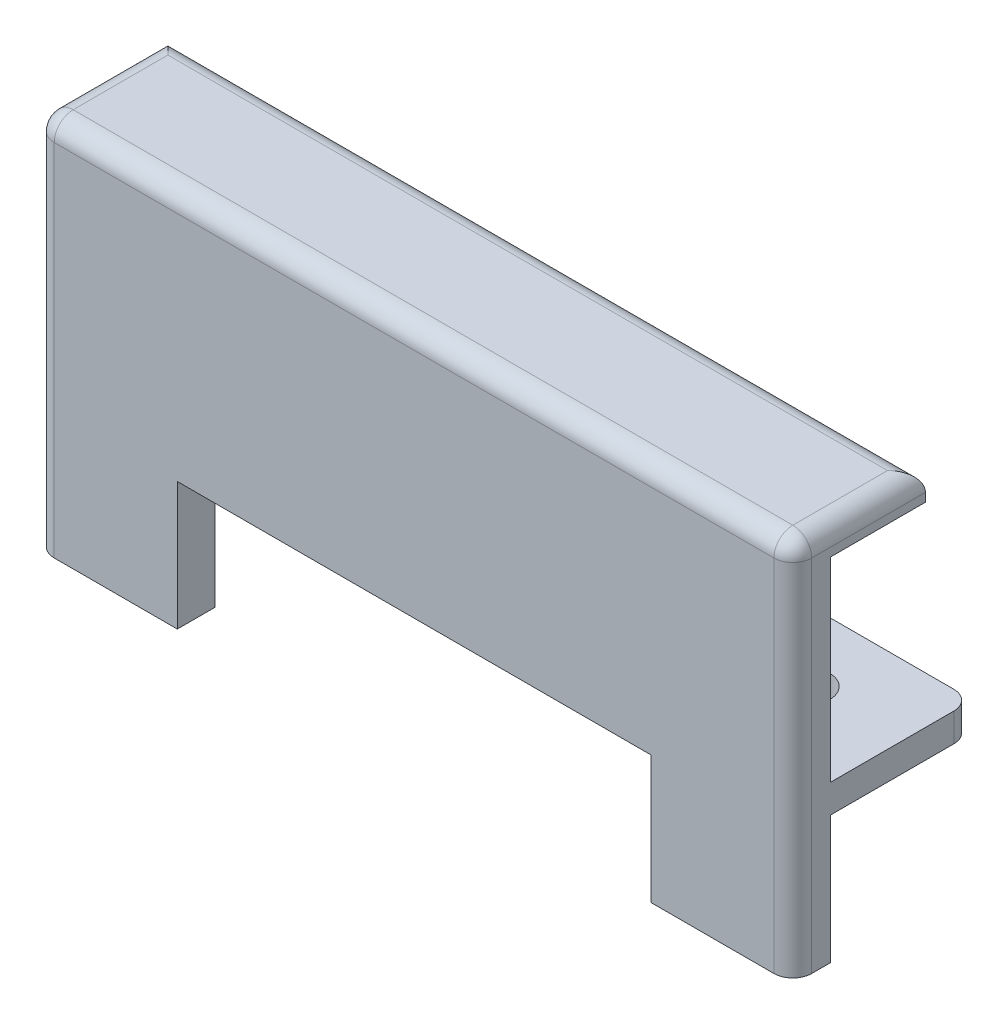
from build123d import *

# Parameters (mm, degrees)
SKETCH_1_R              = 1.7
SKETCH_1_R_2            = 11.5
EXTRUDE_1_DEPTH         = 4
SKETCH_1_4_W            = 80
SKETCH_1_4_H            = 3
EXTRUDE_2_DEPTH         = 10
EXTRUDE_3_DEPTH         = 10
RIB_2_REACH             = 110.093
SKETCH_4_WALL_W         = 240.545785644
SKETCH_4_WALL_H         = 5
SKETCH_5_W              = 2
SKETCH_5_H              = 0.1
SKETCH_5_W_2            = 4.2
SKETCH_5_H_2            = 2
CUT_EXTRUDE_2_DEPTH     = 10
CHAMFER_1_SIZE          = 0.25
SKETCH_6_W              = 91
SKETCH_6_H              = 17
EXTRUDE_4_DEPTH         = 4
SKETCH_7_W              = 80
SKETCH_7_H              = 3.5
EXTRUDE_5_DEPTH         = 15
SKETCH_8_W              = 50
SKETCH_8_H              = 13.5
CUT_EXTRUDE_3_DEPTH     = 102.533245787
CUT_EXTRUDE_4_DEPTH     = 15
CUT_EXTRUDE_5_REACH     = 113.513
SKETCH_10_R             = 2.4
FILLET_1_R              = 10
SKETCH_11_W             = 92.157342817
SKETCH_11_H             = 59.862511732
CUT_EXTRUDE_6_DEPTH     = 103.200782776
CUT_EXTRUDE_START       = -15
CUT_EXTRUDE_7_OUTLINE_W = 80
CUT_EXTRUDE_7_OUTLINE_H = 0.5
CUT_EXTRUDE_7_DEPTH     = 15
FILLET_2_R              = 2


# Read off the part's stored shape, not the designer's step: 切除-拉伸7
with BuildPart() as part:
    # 草图1 → 凸台-拉伸1 (new body)
    with BuildSketch(Plane.XY):
        with BuildLine():
            Line((-70, 13), (-70, -10))
            Line((-70, -10), (21, -10))
            Line((21, -10), (21, 44.755002002))
            ThreePointArc((21, 44.755002002), (20.506939094, 46.920065511), (19.125, 48.658125751))
            ThreePointArc((19.125, 48.658125751), (18, 51), (19.125, 53.341874249))
            ThreePointArc((19.125, 53.341874249), (20.506939094, 55.079934489), (21, 57.244997998))
            Line((21, 57.244997998), (21, 67))
            ThreePointArc((21, 67), (19.535533906, 70.535533906), (16, 72))
            Line((16, 72), (6.244997998, 72))
            ThreePointArc((6.244997998, 72), (4.079934489, 71.506939094), (2.341874249, 70.125))
            ThreePointArc((2.341874249, 70.125), (0, 69), (-2.341874249, 70.125))
            ThreePointArc((-2.341874249, 70.125), (-4.079934489, 71.506939094), (-6.244997998, 72))
            Line((-6.244997998, 72), (-16, 72))
            ThreePointArc((-16, 72), (-19.535533906, 70.535533906), (-21, 67))
            Line((-21, 67), (-21, 57.244997998))
            ThreePointArc((-21, 57.244997998), (-20.506939094, 55.079934489), (-19.125, 53.341874249))
            ThreePointArc((-19.125, 53.341874249), (-18, 51), (-19.125, 48.658125751))
            ThreePointArc((-19.125, 48.658125751), (-20.506939094, 46.920065511), (-21, 44.755002002))
            Line((-21, 44.755002002), (-21, 13))
            Line((-21, 13), (-70, 13))
        make_face()
        with Locations((-15.5, 35.5)):
            Circle(SKETCH_1_R, mode=Mode.SUBTRACT)
        with Locations((-15.5, 66.5)):
            Circle(SKETCH_1_R, mode=Mode.SUBTRACT)
        with Locations((15.5, 35.5)):
            Circle(SKETCH_1_R, mode=Mode.SUBTRACT)
        with Locations((0, 51)):
            Circle(SKETCH_1_R_2, mode=Mode.SUBTRACT)
        with Locations((15.5, 66.5)):
            Circle(SKETCH_1_R, mode=Mode.SUBTRACT)
    extrude(amount=EXTRUDE_1_DEPTH)

    # 草图1<4> → 凸台-拉伸2 (add)
    with BuildSketch(Plane.XY):
        with Locations((-30, 11.5)):
            Rectangle(SKETCH_1_4_W, SKETCH_1_4_H)
    extrude(amount=-EXTRUDE_2_DEPTH)

    # 草图1<5> → 凸台-拉伸3 (add)
    with BuildSketch(Plane.XY):
        Polygon((3.05, 8), (3.05, 10), (-3.05, 10), (-3.05, 8), (-5.05, 8), (-5.05, 6.5), (-4.55, 6), (4.55, 6), (5.05, 6.5), (5.05, 8), align=None)
        Polygon((-16.95, 10), (-23.05, 10), (-23.05, 8), (-25.05, 8), (-25.05, 6.5), (-24.55, 6), (-15.45, 6), (-14.95, 6.5), (-14.95, 8), (-16.95, 8), align=None)
        Polygon((-36.95, 10), (-43.05, 10), (-43.05, 8), (-45.05, 8), (-45.05, 6.5), (-44.55, 6), (-35.45, 6), (-34.95, 6.5), (-34.95, 8), (-36.95, 8), align=None)
        Polygon((-26, 4.55), (-26, -4.55), (-26.5, -5.05), (-28, -5.05), (-28, -3.05), (-32, -3.05), (-32, -5.05), (-33.5, -5.05), (-34, -4.55), (-34, 4.55), (-33.5, 5.05), (-32, 5.05), (-32, 3.05), (-28, 3.05), (-28, 5.05), (-26.5, 5.05), align=None)
        Polygon((-23.05, -8), (-23.05, -10), (-16.95, -10), (-16.95, -8), (-14.95, -8), (-14.95, -6.5), (-15.45, -6), (-24.55, -6), (-25.05, -6.5), (-25.05, -8), align=None)
        Polygon((-43.05, -8), (-43.05, -10), (-36.95, -10), (-36.95, -8), (-34.95, -8), (-34.95, -6.5), (-35.45, -6), (-44.55, -6), (-45.05, -6.5), (-45.05, -8), align=None)
    extrude(amount=-EXTRUDE_3_DEPTH)

    # 草图4 wall → 筋2 (add, up to next)
    with BuildSketch(Plane(origin=(10, 23, -5), x_dir=(0, 0.894427191, 0.4472135955), z_dir=(0, -0.4472135955, 0.894427191)), mode=Mode.PRIVATE) as rib_2_sk1:
        with Locations((0, 2.5)):
            Rectangle(SKETCH_4_WALL_W, SKETCH_4_WALL_H)
    rib_2_tool1 = extrude(rib_2_sk1.sketch, amount=RIB_2_REACH, mode=Mode.PRIVATE) - part.part
    rib_2 = rib_2_tool1.solids().sort_by_distance((10, 23, -5))[0]
    add(rib_2)

    # 镜向1: 筋2 across plane
    add(rib_2.mirror(Plane(origin=(0, 0, 0), x_dir=(0, 0, 1), z_dir=(1, 0, 0))))

    # 草图5 → 切除-拉伸2 (cut)
    with BuildSketch(Plane(origin=(0, 0, -10), x_dir=(-1, 0, 0), z_dir=(0, 0, -1))):
        with Locations((15.95, 7.95)):
            Rectangle(SKETCH_5_W, SKETCH_5_H)
        with Locations((24.05, 7.95)):
            Rectangle(SKETCH_5_W, SKETCH_5_H)
        with Locations((35.95, 7.95)):
            Rectangle(SKETCH_5_W, SKETCH_5_H)
        with Locations((44.05, 7.95)):
            Rectangle(SKETCH_5_W, SKETCH_5_H)
        with Locations((30, 4.05)):
            Rectangle(SKETCH_5_W_2, SKETCH_5_H_2)
        with Locations((30, -4.05)):
            Rectangle(SKETCH_5_W_2, SKETCH_5_H_2)
        with Locations((44.05, -7.95)):
            Rectangle(SKETCH_5_W, SKETCH_5_H)
        with Locations((35.95, -7.95)):
            Rectangle(SKETCH_5_W, SKETCH_5_H)
        with Locations((24.05, -7.95)):
            Rectangle(SKETCH_5_W, SKETCH_5_H)
        with Locations((15.95, -7.95)):
            Rectangle(SKETCH_5_W, SKETCH_5_H)
    extrude(amount=-CUT_EXTRUDE_2_DEPTH, mode=Mode.SUBTRACT)

    # 倒角1
    chamfer_1_edges = [part.edges().sort_by_distance(p)[0] for p in [
        (3.05, 8, -5),
        (5.05, 8, -5),
        (-5.05, 8, -5),
        (-3.05, 8, -5),
        (-16.95, 7.9, -5),
        (-14.95, 7.9, -5),
        (-23.05, 7.9, -5),
        (-25.05, 7.9, -5),
        (-36.95, 7.9, -5),
        (-34.95, 7.9, -5),
        (-43.05, 7.9, -5),
        (-45.05, 7.9, -5),
        (-27.9, 5.05, -5),
        (-32.1, 3.05, -5),
        (-32.1, 5.05, -5),
        (-27.9, 3.05, -5),
        (-32.1, -5.05, -5),
        (-32.1, -3.05, -5),
        (-27.9, -3.05, -5),
        (-27.9, -5.05, -5),
        (-43.05, -7.9, -5),
        (-45.05, -7.9, -5),
        (-36.95, -7.9, -5),
        (-34.95, -7.9, -5),
        (-23.05, -7.9, -5),
        (-25.05, -7.9, -5),
        (-16.95, -7.9, -5),
        (-14.95, -7.9, -5),
    ]]
    chamfer(chamfer_1_edges, length=CHAMFER_1_SIZE)

    # 草图6 → 凸台-拉伸4 (add)
    with BuildSketch(Plane.XY.offset(4)):
        with Locations((-24.5, -18.5)):
            Rectangle(SKETCH_6_W, SKETCH_6_H)
    extrude(amount=-EXTRUDE_4_DEPTH)

    # 草图7 → 凸台-拉伸5 (add)
    with BuildSketch(Plane(origin=(0, 0, 0), x_dir=(-1, 0, 0), z_dir=(0, 0, -1))):
        with Locations((30, -11.75)):
            Rectangle(SKETCH_7_W, SKETCH_7_H)
    extrude(amount=EXTRUDE_5_DEPTH)

    # 草图8 → 切除-拉伸3 (cut, through all)
    with BuildSketch(Plane(origin=(0, 0, 0), x_dir=(-1, 0, 0), z_dir=(0, 0, -1))):
        with Locations((30, -20.25)):
            Rectangle(SKETCH_8_W, SKETCH_8_H)
        with BuildLine():
            Line((-21, -27), (-10, -27))
            Line((-10, -27), (-10, 26))
            ThreePointArc((-10, 26), (-11.171572875, 28.828427125), (-14, 30))
            Line((-14, 30), (-16, 30))
            ThreePointArc((-16, 30), (-19.535533906, 31.464466094), (-21, 35))
            Line((-21, 35), (-21, 30))
            Line((-21, 30), (-21, -27))
        make_face()
    extrude(amount=-CUT_EXTRUDE_3_DEPTH, mode=Mode.SUBTRACT)

    # 草图9 → 切除-拉伸4 (cut)
    with BuildSketch(Plane(origin=(0, 0, -15), x_dir=(-1, 0, 0), z_dir=(0, 0, -1))):
        Polygon((50, -10), (25.452851286, -10), (11.122555598, -10), (11.122555598, 0.364824121), (25.452851286, 0.364824121), (25.452851286, 5.586221175), (50, 5.586221175), align=None)
    extrude(amount=-CUT_EXTRUDE_4_DEPTH, mode=Mode.SUBTRACT)

    # 草图10 → 切除-拉伸5 (cut, up to next)
    with BuildSketch(Plane.XZ.offset(13.5), mode=Mode.PRIVATE) as cut_extrude_5_sk1:
        with Locations(Location((0, -7.5, 0), (0, 0, 270))):
            Circle(SKETCH_10_R)
    cut_extrude_5_tool1 = extrude(cut_extrude_5_sk1.sketch, amount=-CUT_EXTRUDE_5_REACH, mode=Mode.PRIVATE) & part.part
    # 草图10 → 切除-拉伸5 (cut, up to next)
    with BuildSketch(Plane.XZ.offset(13.5), mode=Mode.PRIVATE) as cut_extrude_5_sk2:
        with Locations(Location((-60, -7.5, 0), (0, 0, 270))):
            Circle(SKETCH_10_R)
    cut_extrude_5_tool2 = extrude(cut_extrude_5_sk2.sketch, amount=-CUT_EXTRUDE_5_REACH, mode=Mode.PRIVATE) & part.part
    add(cut_extrude_5_tool1.solids().sort_by_distance((0, -13.5, -7.5))[0], mode=Mode.SUBTRACT)
    add(cut_extrude_5_tool2.solids().sort_by_distance((-60, -13.5, -7.5))[0], mode=Mode.SUBTRACT)

    # 圆角1
    fillet_1_edges = [part.edges().sort_by_distance(p)[0] for p in [
        (-21, 13, 2),
    ]]
    fillet(fillet_1_edges, radius=FILLET_1_R)

    # 草图11 → 切除-拉伸6 (cut, through all)
    with BuildSketch(Plane(origin=(0, 0, -15), x_dir=(-1, 0, 0), z_dir=(0, 0, -1))):
        with Locations((23.921328592, 42.931255866)):
            Rectangle(SKETCH_11_W, SKETCH_11_H)
    extrude(amount=-CUT_EXTRUDE_6_DEPTH, mode=Mode.SUBTRACT)

    # 切除-拉伸7 outline → 切除-拉伸7 (cut)
    with BuildSketch(Plane(origin=(0, 0, -15), x_dir=(-1, 0, 0), z_dir=(0, 0, -1)).offset(CUT_EXTRUDE_START)):
        with Locations((30, -10.25)):
            Rectangle(CUT_EXTRUDE_7_OUTLINE_W, CUT_EXTRUDE_7_OUTLINE_H)
        Polygon((-10, 10.1), (-10, 10), (-3.05, 10), (-3.05, 8.25), (-3.3, 8), (-4.8, 8), (-5.05, 7.75), (-5.05, 6.5), (-4.55, 6), (4.55, 6), (5.05, 6.5), (5.05, 7.75), (4.8, 8), (3.3, 8), (3.05, 8.25), (3.05, 10), (16.95, 10), (16.95, 8.15), (16.7, 7.9), (15.2, 7.9), (14.95, 7.65), (14.95, 6.5), (15.45, 6), (24.55, 6), (25.05, 6.5), (25.05, 7.65), (24.8, 7.9), (23.3, 7.9), (23.05, 8.15), (23.05, 10), (36.95, 10), (36.95, 8.15), (36.7, 7.9), (35.2, 7.9), (34.95, 7.65), (34.95, 6.5), (35.45, 6), (44.55, 6), (45.05, 6.5), (45.05, 7.65), (44.8, 7.9), (43.3, 7.9), (43.05, 8.15), (43.05, 10), (70, 10), (70, 10.1), align=None)
    extrude(amount=CUT_EXTRUDE_7_DEPTH, mode=Mode.SUBTRACT)

    # 圆角2
    fillet_2_edges = [part.edges().sort_by_distance(p)[0] for p in [
        (-70, 13, -3),
        (-70, -12, -15),
        (-30, 13, -10),
        (-70, -7, 4),
        (-30, 13, 4),
        (10, -7, 4),
        (10, 13, -3),
        (10, -12, -15),
    ]]
    fillet(fillet_2_edges, radius=FILLET_2_R)


solid = part.part
